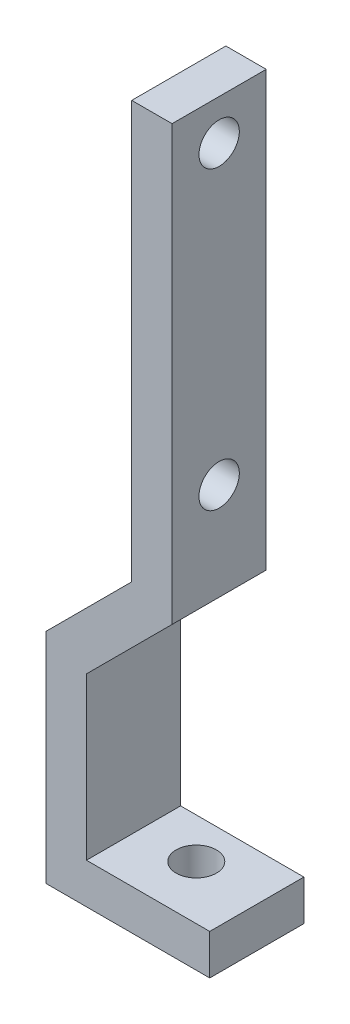
from build123d import *

# Parameters (mm, degrees)
EXTRUDE_1_DEPTH     = 7
SKETCH_2_R          = 1.5
CUT_EXTRUDE_2_DEPTH = 7
SKETCH_4_R          = 1.5
CUT_EXTRUDE_3_DEPTH = 7


with BuildPart() as part:
    # 草图1 → 凸台-拉伸1 (new body)
    with BuildSketch(Plane.XY):
        Polygon((-0.641080243, 21.986723194), (-3.641080243, 21.986723194), (-3.641080243, -9.013276806), (-10.005041274, -15.377237837), (-10.005041274, -31.619878524), (2.158919757, -31.619878524), (2.158919757, -28.619878524), (-7.005041274, -28.619878524), (-7.005041274, -16.619878524), (-0.641080243, -10.255917493), align=None)
    extrude(amount=EXTRUDE_1_DEPTH)

    # 草图2 → 切除-拉伸2 (cut)
    with BuildSketch(Plane.ZY.offset(3.641080243)):
        with Locations((3.5, 18.986723194)):
            Circle(SKETCH_2_R)
        with Locations((3.5, -3.013276806)):
            Circle(SKETCH_2_R)
    extrude(amount=-CUT_EXTRUDE_2_DEPTH, mode=Mode.SUBTRACT)

    # 草图4 → 切除-拉伸3 (cut)
    with BuildSketch(Plane(origin=(0, -28.619878524, 0), x_dir=(1, 0, 0), z_dir=(0, 1, 0))):
        with Locations((-2.841080243, -3)):
            Circle(SKETCH_4_R)
    extrude(amount=-CUT_EXTRUDE_3_DEPTH, mode=Mode.SUBTRACT)


solid = part.part
